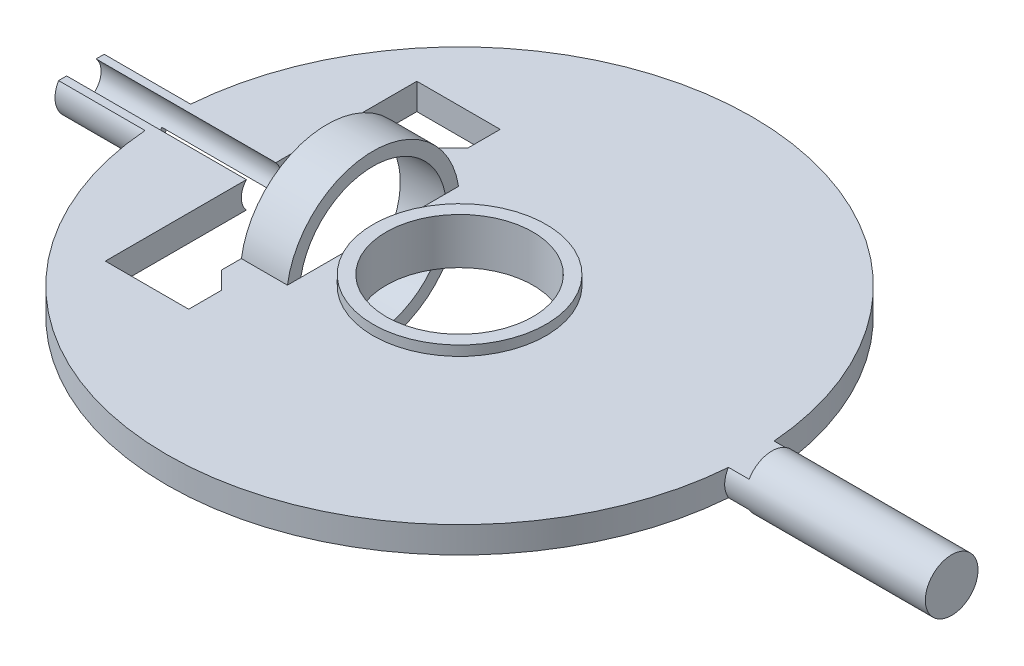
from build123d import *

# Parameters (mm, degrees)
SKETCH1_R                    = 44.45
BOSS_EXTRUDE1_DEPTH          = 2
SKETCH5_R                    = 13.15
SKETCH5_R_2                  = 11.15
BOSS_EXTRUDE2_DEPTH          = 3.5
CUT_EXTRUDE2_DEPTH           = 63.959153425
CUT_EXTRUDE2_DEPTH_BACK      = 63.959153425
SKETCH5_2_R                  = 11.15
BOSS_EXTRUDE4_DEPTH          = 2
CUT_EXTRUDE_THIN1_REACH      = 106.853
CUT_EXTRUDE_THIN1_END_RADIUS = 44.45
SKETCH7_R                    = 8
SKETCH7_R_2                  = 4
BOSS_EXTRUDE6_START          = 30
SKETCH7_3_R                  = 4
BOSS_EXTRUDE6_DEPTH          = 30
BOSS_EXTRUDE7_START          = 27.3
SKETCH11_R                   = 4
BOSS_EXTRUDE7_DEPTH          = 27.3
CUT_EXTRUDE3_REACH           = 160.608
CUT_EXTRUDE3_END_RADIUS      = 13.15
SKETCH13_R                   = 3
SKETCH15_R                   = 13.15
SKETCH15_R_2                 = 11.15
BOSS_EXTRUDE8_DEPTH          = 7
SKETCH15_2_R                 = 11.15
CUT_EXTRUDE4_DEPTH           = 17
CUT_EXTRUDE8_DEPTH           = 91.261993798
CUT_EXTRUDE8_DEPTH_BACK      = 91.261993798
CUT_EXTRUDE9_DEPTH           = 131.696461348
CUT_EXTRUDE10_DEPTH          = 20


with BuildPart() as part:
    # Sketch1 → Boss-Extrude1 (new, symmetric)
    with BuildSketch(Plane(origin=(0, 0, 0), x_dir=(1, 0, 0), z_dir=(0, 1, 0))):
        Circle(SKETCH1_R)
    extrude(amount=BOSS_EXTRUDE1_DEPTH, both=True)

    # Sketch5 → Boss-Extrude2 (add, symmetric)
    with BuildSketch(Plane(origin=(0, 0, 0), x_dir=(1, 0, 0), z_dir=(0, 1, 0))):
        Circle(SKETCH5_R)
        Circle(SKETCH5_R_2, mode=Mode.SUBTRACT)
    extrude(amount=BOSS_EXTRUDE2_DEPTH, both=True)

    # Sketch5<2> → Cut-Extrude2 (cut, two sides: drawn at the far end of the back side and taken through both)
    with BuildSketch(Plane(origin=(0, 0, 0), x_dir=(1, 0, 0), z_dir=(0, 1, 0)).offset(-CUT_EXTRUDE2_DEPTH_BACK)):
        Circle(SKETCH5_2_R)
    extrude(amount=CUT_EXTRUDE2_DEPTH + CUT_EXTRUDE2_DEPTH_BACK, mode=Mode.SUBTRACT)

    # Sketch6 → Boss-Extrude4 (add, symmetric)
    with BuildSketch(Plane(origin=(0, 0, 0), x_dir=(1, 0, 0), z_dir=(0, 1, 0))):
        with BuildLine():
            Line((-44.269656651, 4), (-47.45, 4))
            Line((-47.45, 4), (-47.45, -4))
            Line((-47.45, -4), (-44.269656651, -4))
            ThreePointArc((-44.269656651, -4), (-44.45, 0), (-44.269656651, 4))
        make_face()
        with BuildLine():
            Line((47.45, 4), (44.269656651, 4))
            ThreePointArc((44.269656651, 4), (44.45, 0), (44.269656651, -4))
            Line((44.269656651, -4), (47.45, -4))
            Line((47.45, -4), (47.45, 4))
        make_face()
    extrude(amount=BOSS_EXTRUDE4_DEPTH, both=True)

    # Cut-Extrude-Thin1: up to this cylinder (the profile starts outside it)
    cut_extrude_thin1_end = Plane(origin=(0, 0, 0), z_dir=(0, -1, 0)) * Cylinder(CUT_EXTRUDE_THIN1_END_RADIUS, 303.606, mode=Mode.PRIVATE)
    # Sketch7 → Cut-Extrude-Thin1 (cut, up to the surface)
    with BuildSketch(Plane.ZY.offset(47.45), mode=Mode.PRIVATE) as cut_extrude_thin1_sk1:
        Circle(SKETCH7_R)
        Circle(SKETCH7_R_2, mode=Mode.SUBTRACT)
    cut_extrude_thin1_tool1 = extrude(cut_extrude_thin1_sk1.sketch, amount=-CUT_EXTRUDE_THIN1_REACH, mode=Mode.PRIVATE) - cut_extrude_thin1_end
    cut_extrude_thin1 = cut_extrude_thin1_tool1.solids().sort_by_distance((-47.45, 0, -7.773726))[0]
    add(cut_extrude_thin1, mode=Mode.SUBTRACT)

    # Sketch7<3> → Boss-Extrude6 (add)
    with BuildSketch(Plane.ZY.offset(47.45).offset(BOSS_EXTRUDE6_START)):
        Circle(SKETCH7_3_R)
    extrude(amount=-BOSS_EXTRUDE6_DEPTH)

    # Mirror2: Cut-Extrude-Thin1 across plane
    add(cut_extrude_thin1.mirror(Plane(origin=(0, 0, 0), x_dir=(0, 0, 1), z_dir=(1, 0, 0))), mode=Mode.SUBTRACT)

    # Sketch11 → Boss-Extrude7 (add)
    with BuildSketch(Plane(origin=(47.45, 0, 0), x_dir=(0, 0, -1), z_dir=(1, 0, 0)).offset(BOSS_EXTRUDE7_START)):
        Circle(SKETCH11_R)
    extrude(amount=-BOSS_EXTRUDE7_DEPTH)

    # Cut-Extrude3: up to this cylinder (the profile starts outside it)
    cut_extrude3_end = Plane(origin=(0, 0, 0), z_dir=(0, -1, 0)) * Cylinder(CUT_EXTRUDE3_END_RADIUS, 348.516, mode=Mode.PRIVATE)
    # Sketch13 → Cut-Extrude3 (cut, up to the surface)
    with BuildSketch(Plane.ZY.offset(77.45), mode=Mode.PRIVATE) as cut_extrude3_sk1:
        Circle(SKETCH13_R)
    cut_extrude3_tool1 = extrude(cut_extrude3_sk1.sketch, amount=-CUT_EXTRUDE3_REACH, mode=Mode.PRIVATE) - cut_extrude3_end
    add(cut_extrude3_tool1.solids().sort_by_distance((-77.45, 0, 0))[0], mode=Mode.SUBTRACT)

    # Sketch15 → Boss-Extrude8 (add)
    with BuildSketch(Plane.ZY.offset(13.15)):
        Circle(SKETCH15_R)
        Circle(SKETCH15_R_2, mode=Mode.SUBTRACT)
    extrude(amount=BOSS_EXTRUDE8_DEPTH)

    # Sketch15<2> → Cut-Extrude4 (cut)
    with BuildSketch(Plane.ZY.offset(13.15)):
        Circle(SKETCH15_2_R)
    extrude(amount=CUT_EXTRUDE4_DEPTH, mode=Mode.SUBTRACT)

    # Sketch20 → Cut-Extrude8 (cut, two sides: drawn at the far end of the back side and taken through both)
    with BuildSketch(Plane(origin=(0, 0, 0), x_dir=(1, 0, 0), z_dir=(0, 1, 0)).offset(-CUT_EXTRUDE8_DEPTH_BACK)):
        Polygon((-20.15, -12.15), (-20.15, -16.050923592), (-17.489345312, -18.71157828), (-17.489345312, -23.661456888), (-30.15, -23.661456888), (-30.15, 23.661456888), (-17.489345312, 23.661456888), (-17.489345312, 18.71157828), (-20.15, 16.050923592), (-20.15, 12.15), (-20.15, 0), align=None)
    extrude(amount=CUT_EXTRUDE8_DEPTH + CUT_EXTRUDE8_DEPTH_BACK, mode=Mode.SUBTRACT)

    # Sketch23 → Cut-Extrude9 (cut, through all)
    with BuildSketch(Plane(origin=(-47.45, 0, 0), x_dir=(0, 0, -1), z_dir=(1, 0, 0))):
        with BuildLine():
            Line((-3.464101615, 2), (-2.236067977, 2))
            ThreePointArc((-2.236067977, 2), (0, 3), (2.236067977, 2))
            Line((2.236067977, 2), (3.464101615, 2))
            ThreePointArc((3.464101615, 2), (0, 4), (-3.464101615, 2))
        make_face()
    extrude(amount=-CUT_EXTRUDE9_DEPTH, mode=Mode.SUBTRACT)

    # Sketch24 → Cut-Extrude10 (cut)
    with BuildSketch(Plane.ZY.offset(77.45)):
        with BuildLine():
            Line((-2.236067977, 2), (-3.464101615, 2))
            ThreePointArc((-3.464101615, 2), (0, -4), (3.464101615, 2))
            Line((3.464101615, 2), (2.236067977, 2))
            ThreePointArc((2.236067977, 2), (0, -3), (-2.236067977, 2))
        make_face()
    extrude(amount=-CUT_EXTRUDE10_DEPTH, mode=Mode.SUBTRACT)


solid = part.part
